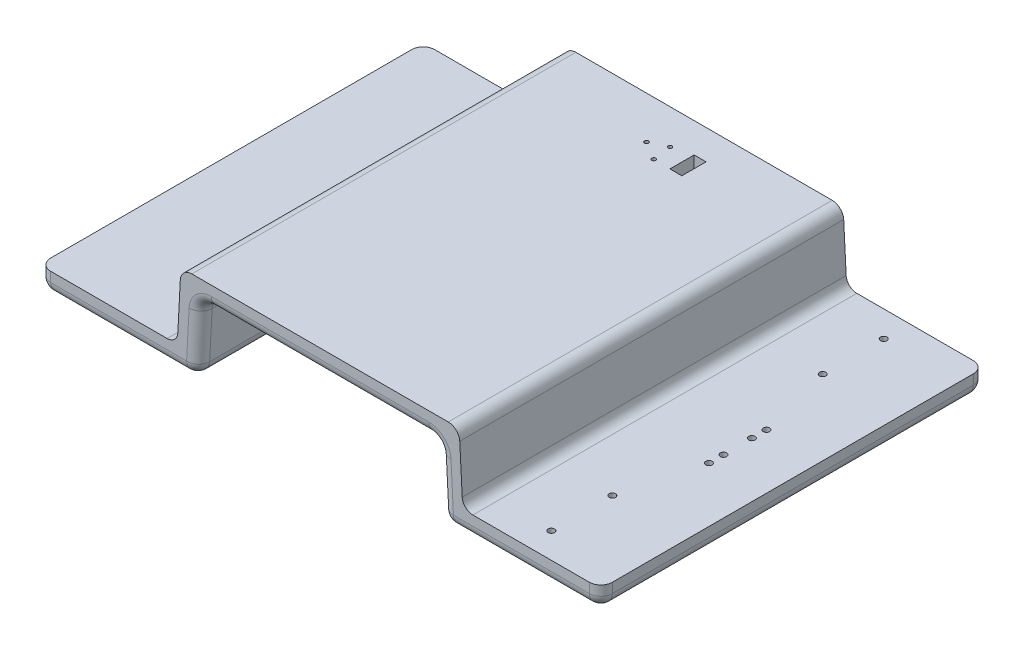
from build123d import *

# Parameters (mm, degrees)
BOSS_EXTRUDE1_DEPTH      = 225
BOSS_EXTRUDE1_DEPTH_BACK = 225
FILLET1_R                = 13.5
FILLET2_R                = 13.5
FILLET3_R                = 13.5
SKETCH2_R                = 3.75
CUT_EXTRUDE1_DEPTH       = 407.610144979
SKETCH3_R                = 2.217250466
SKETCH3_R_2              = 2.287005769
SKETCH3_R_3              = 2.375
SKETCH3_W                = 13.962530501
SKETCH3_H                = 28.400000001
CUT_EXTRUDE2_DEPTH       = 407.610144979


with BuildPart() as part:
    # Sketch1 → Boss-Extrude1 (new, two sides: drawn at the far end of the back side and taken through both)
    with BuildSketch(Plane.XY.offset(-BOSS_EXTRUDE1_DEPTH_BACK)):
        with BuildLine():
            Line((-329.1, -55), (-329.1, -80))
            Line((-329.1, -80), (-156.365701077, -80))
            ThreePointArc((-156.365701077, -80), (-147.072914305, -76.292554009), (-142.884202358, -67.206535409))
            Line((-142.884202358, -67.206535409), (-139.982869184, -11.845800547))
            ThreePointArc((-139.982869184, -11.845800547), (-136.104432196, -3.432820362), (-127.5, 0))
            Line((-127.5, 0), (127.5, 0))
            ThreePointArc((127.5, 0), (136.104432196, -3.432820362), (139.982869184, -11.845800547))
            Line((139.982869184, -11.845800547), (142.884202358, -67.206535409))
            ThreePointArc((142.884202358, -67.206535409), (147.072914305, -76.292554009), (156.365701077, -80))
            Line((156.365701077, -80), (329.1, -80))
            Line((329.1, -80), (329.1, -55))
            Line((329.1, -55), (179.140850678, -55))
            ThreePointArc((179.140850678, -55), (170.536418482, -51.567179638), (166.657981494, -43.154199453))
            Line((166.657981494, -43.154199453), (163.75664832, 12.206535409))
            ThreePointArc((163.75664832, 12.206535409), (159.567936373, 21.292554009), (150.275149601, 25))
            Line((150.275149601, 25), (-150.275149601, 25))
            ThreePointArc((-150.275149601, 25), (-159.567936373, 21.292554009), (-163.75664832, 12.206535409))
            Line((-163.75664832, 12.206535409), (-166.657981494, -43.154199453))
            ThreePointArc((-166.657981494, -43.154199453), (-170.536418482, -51.567179638), (-179.140850678, -55))
            Line((-179.140850678, -55), (-329.1, -55))
        make_face()
    extrude(amount=BOSS_EXTRUDE1_DEPTH + BOSS_EXTRUDE1_DEPTH_BACK)

    # Fillet1
    fillet1_edges = [part.edges().sort_by_distance(p)[0] for p in [
        (-242.732850539, -80, -225),
        (-147.072914305, -76.292554009, -225),
        (-141.433535771, -39.526167978, -225),
        (-136.104432196, -3.432820362, -225),
        (0, 0, -225),
        (136.104432196, -3.432820362, -225),
        (-329.1, -80, 0),
        (141.433535771, -39.526167978, -225),
        (147.072914305, -76.292554009, -225),
        (242.732850539, -80, -225),
        (-242.732850539, -80, 225),
        (-147.072914305, -76.292554009, 225),
        (-141.433535771, -39.526167978, 225),
        (-136.104432196, -3.432820362, 225),
        (0, 0, 225),
        (136.104432196, -3.432820362, 225),
        (141.433535771, -39.526167978, 225),
        (147.072914305, -76.292554009, 225),
        (242.732850539, -80, 225),
    ]]
    fillet(fillet1_edges, radius=FILLET1_R)

    # Fillet2
    fillet2_edges = [part.edges().sort_by_distance(p)[0] for p in [
        (329.1, -80, 0),
        (329.1, -60.75, 225),
        (329.1, -60.75, -225),
        (329.1, -76.045941546, 221.045941546),
        (329.1, -76.045941546, -221.045941546),
    ]]
    fillet(fillet2_edges, radius=FILLET2_R)

    # Fillet3
    # the kernel refuses this fillet: 13.5 mm, written as the material it takes off along each edge
    with BuildSketch(Plane(origin=(-315.6, -66.5, 211.5), x_dir=(0, 0, 1), z_dir=(-1, 0, 0))) as fillet3_piece_1_section:
        Polygon((0, 0), (FILLET3_R, 0), (FILLET3_R, -FILLET3_R), (0, -FILLET3_R), align=None)
    fillet3_piece_1 = extrude(amount=FILLET3_R, mode=Mode.PRIVATE)
    fillet3_piece_1 = fillet3_piece_1 - Plane(origin=(-315.6, -66.5, 211.5), x_dir=(0, 0.7071067811865475, -0.7071067811865475), z_dir=(-1, 0, 0)) * Sphere(FILLET3_R, mode=Mode.PRIVATE)
    add(fillet3_piece_1, mode=Mode.SUBTRACT)
    with BuildSketch(Plane(origin=(-315.6, -66.5, -211.5), x_dir=(-1, 0, 0), z_dir=(0, 0, -1))) as fillet3_piece_2_section:
        Polygon((0, 0), (FILLET3_R, 0), (FILLET3_R, -FILLET3_R), (0, -FILLET3_R), align=None)
    fillet3_piece_2 = extrude(amount=FILLET3_R, mode=Mode.PRIVATE)
    fillet3_piece_2 = fillet3_piece_2 - Plane(origin=(-315.6, -66.5, -211.5), x_dir=(0.7071067811865475, 0.7071067811865475, 0), z_dir=(0, 0, -1)) * Sphere(FILLET3_R, mode=Mode.PRIVATE)
    add(fillet3_piece_2, mode=Mode.SUBTRACT)
    with BuildSketch(Plane(origin=(-329.1, -21.25, 225), x_dir=(0, 0, -1), z_dir=(0, -1, 0)), Plane(origin=(-329.1, -21.25, -225), x_dir=(1, 0, 0), z_dir=(0, -1, 0))) as fillet3_piece_3:
        with BuildLine():
            CenterArc((FILLET3_R, FILLET3_R), FILLET3_R, 180, 90)
            Line((0, FILLET3_R), (0, 0))
            Line((0, 0), (FILLET3_R, 0))
        make_face()
    extrude(amount=45.25, mode=Mode.SUBTRACT)

    # Sketch2 → Cut-Extrude1 (cut, through all)
    with BuildSketch(Plane(origin=(0, -55, 0), x_dir=(1, 0, 0), z_dir=(0, 1, 0))):
        with Locations(Location((264.653924111, 33.529574354, 0), (0, 0, 180))):
            Circle(SKETCH2_R)
        with Locations(Location((264.653924111, 16.529574354, 0), (0, 0, 180))):
            Circle(SKETCH2_R)
        with Locations(Location((264.805133934, -17, 0), (0, 0, 180))):
            Circle(SKETCH2_R)
        with Locations(Location((264.805133934, -34, 0), (0, 0, 180))):
            Circle(SKETCH2_R)
        with Locations(Location((241.140850678, -195, 0), (0, 0, 180))):
            Circle(SKETCH2_R)
        with Locations(Location((241.140850678, -123.52, 0), (0, 0, 180))):
            Circle(SKETCH2_R)
        with Locations(Location((241.140850678, 123.049574354, 0), (0, 0, 180))):
            Circle(SKETCH2_R)
        with Locations(Location((241.140850678, 194.529574354, 0), (0, 0, 180))):
            Circle(SKETCH2_R)
    extrude(amount=-CUT_EXTRUDE1_DEPTH, mode=Mode.SUBTRACT)

    # Sketch3 → Cut-Extrude2 (cut, through all)
    with BuildSketch(Plane.XZ):
        with Locations((1.08258839, -184.160446131)):
            Circle(SKETCH3_R)
        with Locations((4.060016021, -162.119555044)):
            Circle(SKETCH3_R_2)
        with Locations((-17.624379629, -175.332)):
            Circle(SKETCH3_R_3)
        with Locations((30.315969329, -175.921080945)):
            Rectangle(SKETCH3_W, SKETCH3_H)
    extrude(amount=-CUT_EXTRUDE2_DEPTH, mode=Mode.SUBTRACT)


solid = part.part
